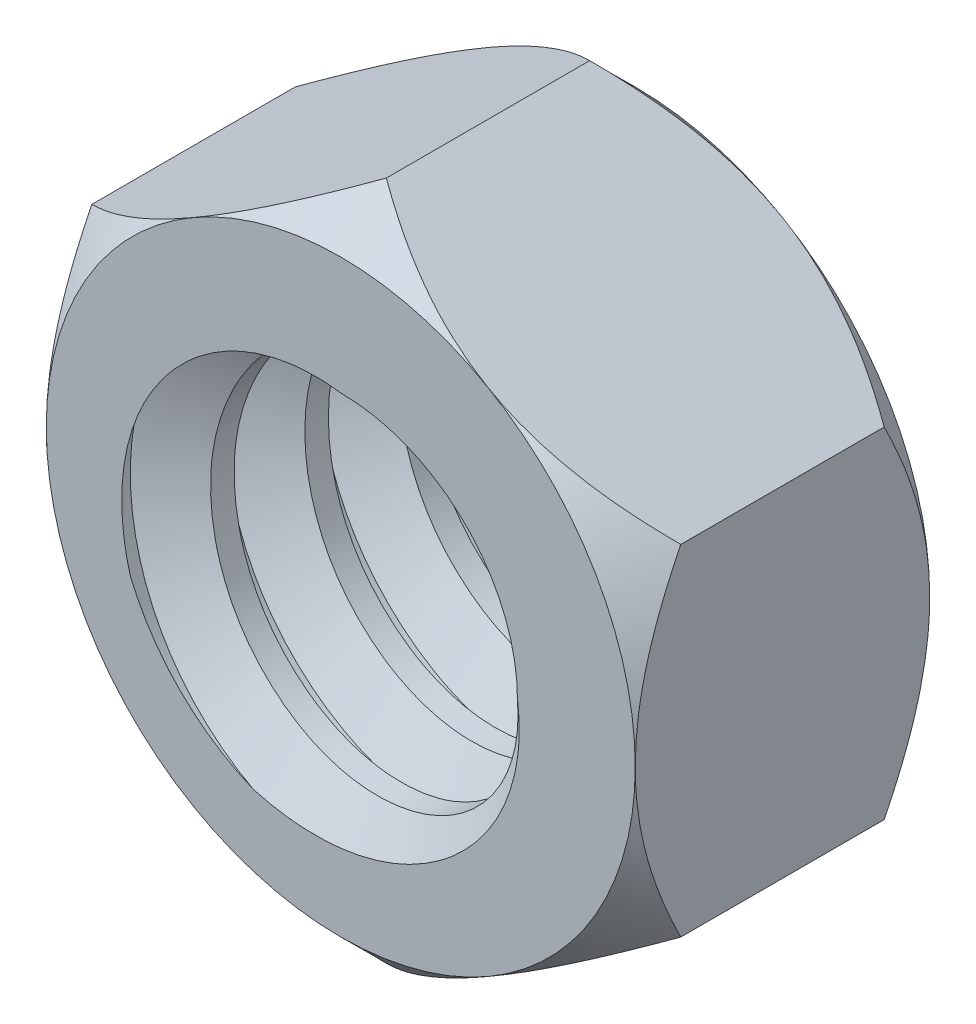
from build123d import *

# Parameters (mm, degrees)
BOSS_EXTRUDE1_DEPTH     = 1.25
SKETCH8_OUTSIDE_W       = 28.608
SKETCH8_OUTSIDE_H       = 29.382
SKETCH8_OUTSIDE_R       = 2.5
CUT_EXTRUDE4_DEPTH      = 10
CUT_EXTRUDE4_DRAFT      = -45
MIRROR1_COPY_1_SKETCH_W = 28.608
MIRROR1_COPY_1_SKETCH_H = 29.382
MIRROR1_COPY_1_SKETCH_R = 2.5
MIRROR1_COPY_1_DEPTH    = 10
MIRROR1_COPY_1_DRAFT    = -45
CUT_EXTRUDE5_DEPTH      = 10
CUT_EXTRUDE5_DEPTH_BACK = 10
SKETCH1_4_R             = 1.5
THREAD2_PITCH           = 0.8
SCALE1_SCALE            = 1.666666667


with BuildPart() as part:
    # Sketch1 → Boss-Extrude1 (new, symmetric)
    with BuildSketch(Plane.XY):
        Polygon((0, 2.886751346), (-2.5, 1.443375673), (-2.5, -1.443375673), (0, -2.886751346), (2.5, -1.443375673), (2.5, 1.443375673), align=None)
    extrude(amount=BOSS_EXTRUDE1_DEPTH, both=True)


with BuildPart() as cut_extrude4_tool:
    # Sketch8 outside → Cut-Extrude4 (with draft: the straight prism first)
    with BuildSketch(Plane.XY.offset(1.25)):
        Rectangle(SKETCH8_OUTSIDE_W, SKETCH8_OUTSIDE_H)
        Circle(SKETCH8_OUTSIDE_R, mode=Mode.SUBTRACT)
    extrude(amount=-CUT_EXTRUDE4_DEPTH)
    # Cut-Extrude4: the draft: its side faces are tilted about the plane it starts from
    cut_extrude4_sides = [cut_extrude4_tool.faces().sort_by_distance(p)[0] for p in [
        (0, -14.691, -3.75),
        (14.304, 0, -3.75),
        (0, 14.691, -3.75),
        (-14.304, 0, -3.75),
        (-2.5, 0, -3.75),
    ]]
    draft(cut_extrude4_sides, Plane.XY.offset(1.25), CUT_EXTRUDE4_DRAFT)


with BuildPart() as part_1:
    add(part.part)

    # Cut-Extrude4: cut by cut_extrude4_tool
    add(cut_extrude4_tool.part, mode=Mode.SUBTRACT)


with BuildPart() as mirror1_copy_1_tool:
    # Mirror1 copy 1 sketch → Mirror1 copy 1 (with draft: the straight prism first)
    with BuildSketch(Plane(origin=(0, 0, -1.25), x_dir=(1, 0, 0), z_dir=(0, 0, -1))):
        Rectangle(MIRROR1_COPY_1_SKETCH_W, MIRROR1_COPY_1_SKETCH_H)
        Circle(MIRROR1_COPY_1_SKETCH_R, mode=Mode.SUBTRACT)
    extrude(amount=-MIRROR1_COPY_1_DEPTH)
    # Mirror1 copy 1: the draft: its side faces are tilted about the plane it starts from
    mirror1_copy_1_sides = [mirror1_copy_1_tool.faces().sort_by_distance(p)[0] for p in [
        (0, -14.691, 3.75),
        (14.304, 0, 3.75),
        (0, 14.691, 3.75),
        (-14.304, 0, 3.75),
        (-2.5, 0, 3.75),
    ]]
    draft(mirror1_copy_1_sides, Plane(origin=(0, 0, -1.25), x_dir=(1, 0, 0), z_dir=(0, 0, -1)), MIRROR1_COPY_1_DRAFT)


with BuildPart() as part_2:
    add(part_1.part)

    # Mirror1 copy 1: cut by mirror1_copy_1_tool
    add(mirror1_copy_1_tool.part, mode=Mode.SUBTRACT)

    # Sketch1<4> → Cut-Extrude5 (cut, two sides: drawn at the far end of the back side and taken through both)
    with BuildSketch(Plane.XY.offset(-CUT_EXTRUDE5_DEPTH_BACK)):
        Circle(SKETCH1_4_R)
    extrude(amount=CUT_EXTRUDE5_DEPTH + CUT_EXTRUDE5_DEPTH_BACK, mode=Mode.SUBTRACT)

    # Thread2: the profile of Thread Profile3 profile screwed along a right-hand helix of 12.5 turns, 8 arcs to a turn; built about Z, then put on its axis
    thread2_z = Axis((0, 0, 0), (0, 0, 1))
    thread2_corners = [(1.4997, 0, -0.000173205), (1.9330127, 0, 0.249999999), (1.9330127, 0, 0.349999999), (1.4997, 0, 0.600173203)]
    with BuildLine(mode=Mode.PRIVATE) as thread2_profile:
        Line(thread2_corners[0], thread2_corners[1])
        Line(thread2_corners[1], thread2_corners[2])
        Line(thread2_corners[2], thread2_corners[3])
        Line(thread2_corners[3], thread2_corners[0])
    thread2_cap = Face(thread2_profile.wire())
    thread2_turn_angles = [0, 22.5, 45, 67.5, 90, 112.5, 135, 157.5, 180, 202.5, 225, 247.5, 270, 292.5, 315, 337.5, 360]
    thread2_turn_weights = [1, 0.9238795325112867, 1, 0.9238795325112867, 1, 0.9238795325112867, 1, 0.9238795325112867, 1, 0.9238795325112867, 1, 0.9238795325112867, 1, 0.9238795325112867, 1, 0.9238795325112867, 1]
    thread2_turn_rails = [Edge.make_bspline([Vector(p[0], p[1], 0).rotate(thread2_z, thread2_turn_angles[k]) / thread2_turn_weights[k] + Vector(0, 0, p[2] + THREAD2_PITCH * thread2_turn_angles[k] / 360) for k in range(17)], [0, 0, 0, 1, 1, 2, 2, 3, 3, 4, 4, 5, 5, 6, 6, 7, 7, 8, 8, 8], 2, thread2_turn_weights) for p in thread2_corners]
    thread2_turn_sides = [Face.make_surface_from_curves(thread2_turn_rails[p[0]], thread2_turn_rails[p[1]]) for p in [(0, 1), (1, 2), (2, 3), (3, 0)]]
    thread2_last_angles = [4320, 4342.5, 4365, 4387.5, 4410, 4432.5, 4455, 4477.5, 4500]
    thread2_last_weights = [1, 0.9238795325112867, 1, 0.9238795325112867, 1, 0.9238795325112867, 1, 0.9238795325112867, 1]
    thread2_last_rails = [Edge.make_bspline([Vector(p[0], p[1], 0).rotate(thread2_z, thread2_last_angles[k]) / thread2_last_weights[k] + Vector(0, 0, p[2] + THREAD2_PITCH * thread2_last_angles[k] / 360) for k in range(9)], [0, 0, 0, 1, 1, 2, 2, 3, 3, 4, 4, 4], 2, thread2_last_weights) for p in thread2_corners]
    thread2_last_sides = [Face.make_surface_from_curves(thread2_last_rails[p[0]], thread2_last_rails[p[1]]) for p in [(0, 1), (1, 2), (2, 3), (3, 0)]]
    thread2 = Plane(origin=(0, 0, 2.25), x_dir=(-1, 0, 0), z_dir=(0, 0, -1)) * Solid(Shell([*[p.moved(Location((0, 0, THREAD2_PITCH * i))) for i in range(12) for p in thread2_turn_sides], *thread2_last_sides, thread2_cap, thread2_cap.rotate(thread2_z, 4500).moved(Location((0, 0, THREAD2_PITCH * 4500 / 360)))]))
    add(thread2, mode=Mode.SUBTRACT)


with BuildPart() as part_3:
    # Scale1: scaled about (0.004861614, 0.002588167, 0.000206225)
    add(part_2.part.scale(SCALE1_SCALE).moved(Location((-0.003241076, -0.001725445, -0.000137483))))


solid = part_3.part
